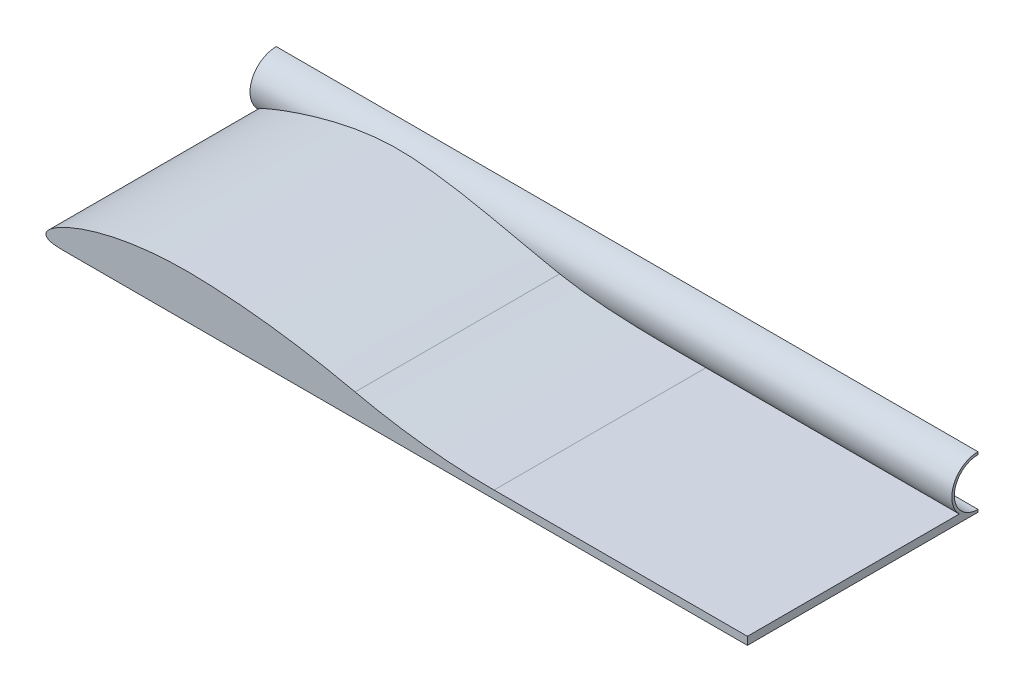
from build123d import *

# Parameters (mm, degrees)
BOSS_EXTRUDE1_DEPTH     = 185.42
FILLET1_R               = 508
BOSS_EXTRUDE2_START     = -0.366692026
BOSS_EXTRUDE2_DEPTH     = 564.246692026
CUT_EXTRUDE1_DEPTH      = 596.178860778
CUT_EXTRUDE1_DEPTH_BACK = 596.178860778


# Read off the part's stored shape, not the designer's step: Boss-Extrude2
with BuildPart() as part:
    # Sketch1 → Boss-Extrude1 (new body)
    with BuildSketch(Plane.XY):
        with BuildLine():
            add(Edge.make_bspline(
                [(13.161115253, -3.654646631), (13.823623725, -3.654646631), (16.987832029, -3.616054402), (23.087716531, -3.309495072), (31.861742479, -2.560725044), (41.843709875, -1.536189628), (52.931986121, -0.324549043), (65.008512648, 0.982737613), (77.964122557, 2.277511633), (91.674031486, 3.446601281), (106.020407657, 4.412124839), (120.955345623, 5.051776243), (136.33914131, 5.410297234), (152.00771634, 5.729330171), (167.715786189, 5.891355535), (183.286749283, 5.907819478), (198.553027185, 5.759500833), (213.347799024, 5.457376615), (227.508384674, 5.013382487), (240.87707765, 4.458546495), (253.302348042, 3.819562542), (264.636493621, 3.140644353), (274.759317931, 2.451673351), (283.511762664, 1.803338009), (290.902443864, 1.207394425), (296.53666063, 0.74243374), (301.097723542, 0.310240549), (302.984341567, 0.206591886), (304.793276654, -0.029609745), (304.8, 0)],
                knots=[0.530802003, 0.530802003, 0.530802003, 0.530802003, 0.533991629, 0.546033957, 0.560220284, 0.576403357, 0.594370816, 0.613951104, 0.634916885, 0.657088503, 0.68022991, 0.704175481, 0.729090367, 0.754353776, 0.779667752, 0.80476012, 0.829359339, 0.85320871, 0.876041363, 0.897604065, 0.917662212, 0.93596986, 0.952309788, 0.966502759, 0.978350083, 0.987731492, 0.99451092, 0.998633933, 1, 1, 1, 1], degree=3))
            Line((13.161115253, -3.654646631), (563.88, -3.654646631))
            Line((563.88, -3.654646631), (563.88, 2.695353369))
            Line((563.88, 2.695353369), (295.985175517, 2.695353369))
            add(Edge.make_bspline(
                [(304.8, 0), (304.806765113, 0.029793691), (303.042265442, 0.505757681), (301.260699108, 1.131288287), (298.363634875, 1.98706409), (296.481226949, 2.547598218), (295.985175517, 2.695353369)],
                knots=[0, 0, 0, 0, 0.001374553, 0.005484497, 0.012273361, 0.014741887, 0.014741887, 0.014741887, 0.014741887], degree=3))
        make_face()
        with BuildLine():
            add(Edge.make_bspline(
                [(304.8, 0), (304.806765113, 0.029793691), (303.042265442, 0.505757681), (301.260699108, 1.131288287), (296.859481645, 2.431382143), (291.428347564, 4.059507507), (284.27148123, 6.106238287), (275.759062516, 8.441011906), (265.86759503, 11.013912173), (254.728284103, 13.723951628), (242.452197766, 16.50134202), (229.161916523, 19.249453844), (215.002240334, 21.891859808), (200.122077246, 24.347664434), (184.681833302, 26.544941892), (168.851714948, 28.423390706), (152.808183209, 29.930661937), (136.726583629, 31.004871005), (120.70505044, 31.68890838), (104.913675716, 31.696173318), (89.564892405, 30.886228683), (74.937803443, 29.370910292), (61.220730955, 27.223316908), (48.586751334, 24.554045511), (37.186133391, 21.501101472), (27.155274661, 18.197077887), (18.596928301, 14.804467146), (11.606371729, 11.436038832), (6.205374616, 8.263160289), (2.462071155, 5.310219357), (0.172825892, 2.718078099), (-0.366692026, -0.10672571), (1.618538644, -2.175191533), (4.903129138, -3.111787797), (9.54050067, -3.659044511), (15.622325024, -3.684680114), (23.087716531, -3.309495072), (31.861742479, -2.560725044), (41.843709875, -1.536189628), (52.931986121, -0.324549043), (65.008512648, 0.982737613), (77.964122557, 2.277511633), (91.674031486, 3.446601281), (106.020407657, 4.412124839), (120.955345623, 5.051776243), (136.33914131, 5.410297234), (152.00771634, 5.729330171), (167.715786189, 5.891355535), (183.286749283, 5.907819478), (198.553027185, 5.759500833), (213.347799024, 5.457376615), (227.508384674, 5.013382487), (240.87707765, 4.458546495), (253.302348042, 3.819562542), (264.636493621, 3.140644353), (274.759317931, 2.451673351), (283.511762664, 1.803338009), (290.902443864, 1.207394425), (296.53666063, 0.74243374), (301.097723542, 0.310240549), (302.984341567, 0.206591886), (304.793276654, -0.029609745), (304.8, 0)],
                knots=[0, 0, 0, 0, 0.001374553, 0.005484497, 0.012273361, 0.021682196, 0.033580612, 0.047830743, 0.064305953, 0.082777332, 0.103063756, 0.124929017, 0.148149111, 0.172444695, 0.197572106, 0.223268881, 0.249227775, 0.275186209, 0.300900709, 0.326462938, 0.351222485, 0.374905859, 0.397269706, 0.418072414, 0.437079533, 0.454093094, 0.468919632, 0.481391712, 0.491447127, 0.499023571, 0.504293734, 0.507921918, 0.511539686, 0.516780528, 0.52421649, 0.533991629, 0.546033957, 0.560220284, 0.576403357, 0.594370816, 0.613951104, 0.634916885, 0.657088503, 0.68022991, 0.704175481, 0.729090367, 0.754353776, 0.779667752, 0.80476012, 0.829359339, 0.85320871, 0.876041363, 0.897604065, 0.917662212, 0.93596986, 0.952309788, 0.966502759, 0.978350083, 0.987731492, 0.99451092, 0.998633933, 1, 1, 1, 1], degree=3))
        make_face()
    extrude(amount=BOSS_EXTRUDE1_DEPTH)

    # Fillet1
    fillet1_edges = [part.edges().sort_by_distance(p)[0] for p in [
        (295.985175517, 2.695353369, 92.71),
    ]]
    fillet(fillet1_edges, radius=FILLET1_R)

    # Boss-Extrude2 outline → Boss-Extrude2 (add)
    with BuildSketch(Plane(origin=(0, 0, 0), x_dir=(0, 0, -1), z_dir=(1, 0, 0)).offset(BOSS_EXTRUDE2_START)):
        with BuildLine():
            Line((0, -3.654646631), (0, 38.509353369))
            ThreePointArc((0, 38.509353369), (-21.082, 17.427353369), (0, -3.654646631))
        make_face()
    extrude(amount=BOSS_EXTRUDE2_DEPTH)

    # Sketch3 → Cut-Extrude1 (cut, two sides: drawn at the far end of the back side and taken through both)
    with BuildSketch(Plane.ZY.offset(0.366692026).offset(-CUT_EXTRUDE1_DEPTH_BACK)):
        with BuildLine():
            Line((0, 36.477353369), (0, -1.622646631))
            ThreePointArc((0, -1.622646631), (19.05, 17.427353369), (0, 36.477353369))
        make_face()
    extrude(amount=CUT_EXTRUDE1_DEPTH + CUT_EXTRUDE1_DEPTH_BACK, mode=Mode.SUBTRACT)


solid = part.part
